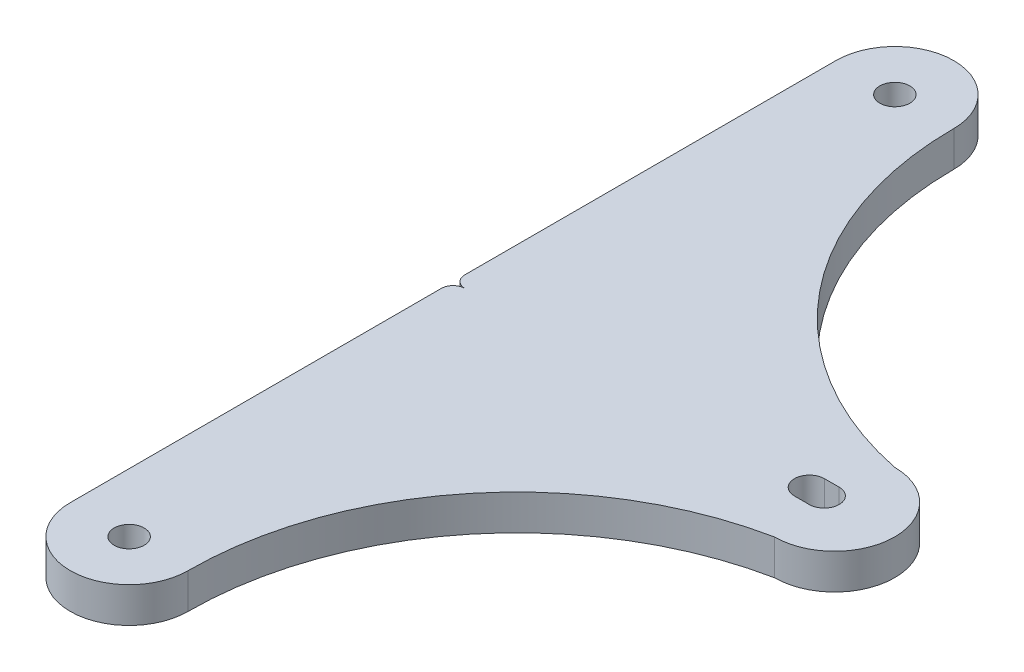
from build123d import *

# Parameters (mm, degrees)
EXTRUDE_1_DEPTH     = 6
SKETCH_2_R          = 2.55
CUT_EXTRUDE_1_DEPTH = 86.226323755
CUT_EXTRUDE_2_DEPTH = 86.226323755


with BuildPart() as part:
    # Эскиз1 → Бобышка-Вытянуть1 (new body)
    with BuildSketch(Plane(origin=(0, 0, 0), x_dir=(1, 0, 0), z_dir=(0, 1, 0))):
        with BuildLine():
            Line((-35, -65), (-35, 65))
            ThreePointArc((-35, 65), (-25, 75), (-15, 65))
            ThreePointArc((-15, 65), (-2.372594749, 29.596870998), (29.809139443, 10.176034483))
            ThreePointArc((29.809139443, 10.176034483), (40.031565804, -0.046391879), (29.809139443, -10.26881824))
            ThreePointArc((29.809139443, -10.26881824), (-2.368853025, -29.632779179), (-15, -65))
            ThreePointArc((-15, -65), (-25, -75), (-35, -65))
        make_face()
    extrude(amount=EXTRUDE_1_DEPTH)

    # Эскиз2 → Вырез-Вытянуть1 (cut, through all)
    with BuildSketch(Plane.XZ):
        with Locations((-25, -65)):
            Circle(SKETCH_2_R)
        with Locations((-25, 65)):
            Circle(SKETCH_2_R)
        with BuildLine():
            Line((28, -2.55), (25.5, -2.55))
            ThreePointArc((25.5, -2.55), (22.95, 0), (25.5, 2.55))
            Line((25.5, 2.55), (28, 2.55))
            ThreePointArc((28, 2.55), (30.55, 0), (28, -2.55))
        make_face()
    extrude(amount=-CUT_EXTRUDE_1_DEPTH, mode=Mode.SUBTRACT)

    # Эскиз3 → Вырез-Вытянуть2 (cut, through all)
    with BuildSketch(Plane.XZ):
        with BuildLine():
            Line((-35, -2), (-35, 2))
            ThreePointArc((-35, 2), (-34.414213562, 0.585786438), (-33, 0))
            ThreePointArc((-33, 0), (-34.414213562, -0.585786438), (-35, -2))
        make_face()
    extrude(amount=-CUT_EXTRUDE_2_DEPTH, mode=Mode.SUBTRACT)


solid = part.part
